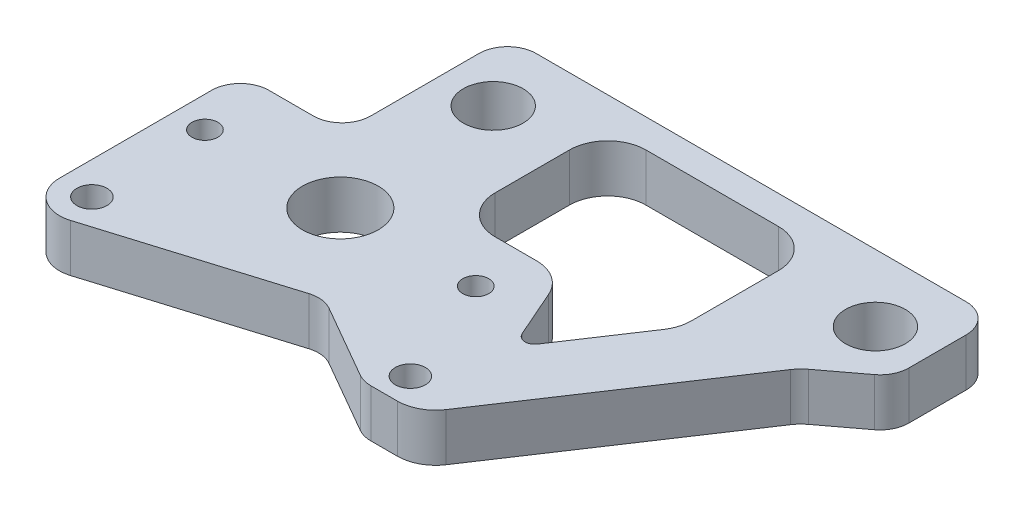
from build123d import *

# Parameters (mm, degrees)
SKETCH4_R           = 2
SKETCH4_R_2         = 1.7272
SKETCH4_R_3         = 5.04
SKETCH4_R_4         = 3.96875
BOSS_EXTRUDE2_DEPTH = 6.35
FILLET1_R           = 5.08
FILLET2_R           = 5.08
FILLET3_R           = 1.27


with BuildPart() as part:
    # Sketch4 → Boss-Extrude2 (new body)
    with BuildSketch(Plane(origin=(0, 0, 0), x_dir=(1, 0, 0), z_dir=(0, 1, 0))):
        with BuildLine():
            Line((22.483900583, -18.4375), (28.735494078, -18.4375))
            Line((28.735494078, -18.4375), (48.985566477, 12.027918285))
            Line((48.985566477, 12.027918285), (54.680415238, 16.319294633))
            ThreePointArc((54.680415238, 16.319294633), (55.797199918, 17.662082259), (56.1975, 19.362095927))
            Line((56.1975, 19.362095927), (56.1975, 26.9875))
            ThreePointArc((56.1975, 26.9875), (55.081576836, 29.681576836), (52.3875, 30.7975))
            Line((52.3875, 30.7975), (-4.7625, 30.7975))
            ThreePointArc((-4.7625, 30.7975), (-7.456576836, 29.681576836), (-8.5725, 26.9875))
            Line((-8.5725, 26.9875), (-8.5725, 12.607500122))
            ThreePointArc((-8.5725, 12.607500122), (-9.688423164, 9.913423286), (-12.3825, 8.797500122))
            Line((-12.3825, 8.797500122), (-18.288, 8.797500122))
            ThreePointArc((-18.288, 8.797500122), (-20.982076836, 7.681576958), (-22.098, 4.987500122))
            Line((-22.098, 4.987500122), (-22.098, -15.24))
            ThreePointArc((-22.098, -15.24), (-20.348558836, -18.710969534), (-16.517810325, -19.369406885))
            Line((-16.517810325, -19.369406885), (7.765559219, -11.946980575))
            ThreePointArc((7.765559219, -11.946980575), (9.307944036, -11.804768953), (10.779476649, -12.288263354))
            Line((10.779476649, -12.288263354), (20.583679925, -17.929811531))
            ThreePointArc((20.583679925, -17.929811531), (21.500464498, -18.308390309), (22.483900583, -18.4375))
        make_face()
        with Locations((-17.78, -15.24)):
            Circle(SKETCH4_R, mode=Mode.SUBTRACT)
        with Locations((-18.000000004, 0)):
            Circle(SKETCH4_R_2, mode=Mode.SUBTRACT)
        Circle(SKETCH4_R_3, mode=Mode.SUBTRACT)
        with Locations((24.012521227, -14.703599027)):
            Circle(SKETCH4_R, mode=Mode.SUBTRACT)
        with Locations((18.000000004, 0)):
            Circle(SKETCH4_R_2, mode=Mode.SUBTRACT)
        with Locations((-1.5875, 21.9075)):
            Circle(SKETCH4_R_4, mode=Mode.SUBTRACT)
        with BuildLine():
            ThreePointArc((8.544719667, 21.9075), (10.032617219, 25.499602448), (13.624719667, 26.9875))
            Line((13.624719667, 26.9875), (31.244858643, 26.9875))
            ThreePointArc((31.244858643, 26.9875), (34.836961091, 25.499602448), (36.324858643, 21.9075))
            Line((36.324858643, 21.9075), (36.324858643, 16.899253972))
            Line((36.324858643, 16.899253972), (36.324858643, 8.797500122))
            Line((36.324858643, 8.797500122), (27.479059604, -4.510648238))
            Line((27.479059604, -4.510648238), (22.434789155, 6.9625))
            Line((22.434789155, 6.9625), (13.624719667, 6.9625))
            ThreePointArc((13.624719667, 6.9625), (10.032617219, 8.450397552), (8.544719667, 12.0425))
            Line((8.544719667, 12.0425), (8.544719667, 21.9075))
        make_face(mode=Mode.SUBTRACT)
        with Locations((49.2125, 21.9075)):
            Circle(SKETCH4_R_4, mode=Mode.SUBTRACT)
    extrude(amount=-BOSS_EXTRUDE2_DEPTH)

    # Fillet1
    fillet1_edges = [part.edges().sort_by_distance(p)[0] for p in [
        (48.985566477, -3.175, -12.027918285),
        (28.735494078, -3.175, 18.4375),
    ]]
    fillet(fillet1_edges, radius=FILLET1_R)

    # Fillet2
    fillet2_edges = [part.edges().sort_by_distance(p)[0] for p in [
        (22.434789155, -3.175, -6.9625),
        (36.324858643, -3.175, -8.797500122),
    ]]
    fillet(fillet2_edges, radius=FILLET2_R)

    # Fillet3
    fillet3_edges = [part.edges().sort_by_distance(p)[0] for p in [
        (27.479059604, -3.175, 4.510648238),
    ]]
    fillet(fillet3_edges, radius=FILLET3_R)


solid = part.part
